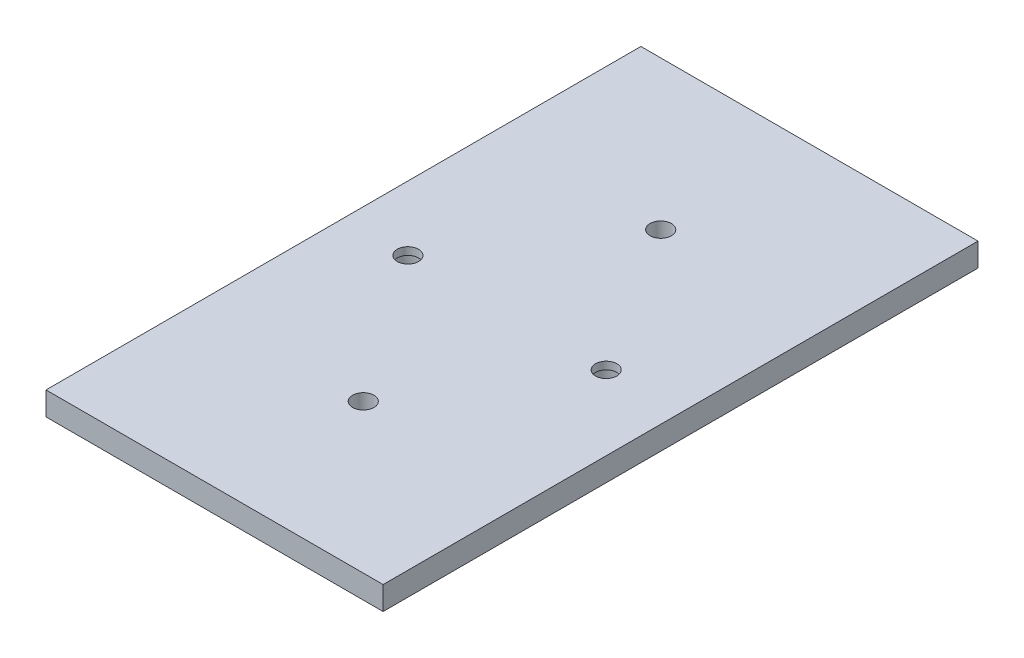
from build123d import *

# Parameters (mm, degrees)
SKETCH2_W               = 88.9
SKETCH2_H               = 152.4
BOSS_EXTRUDE1_DEPTH     = 5.9944
CUT_EXTRUDE2_DEPTH      = 177.535840076
CUT_EXTRUDE2_DEPTH_BACK = 177.535840076
SKETCH4_R               = 2.7305
CUT_EXTRUDE3_DEPTH      = 177.535840076
CUT_EXTRUDE3_DEPTH_BACK = 177.535840076
SKETCH5_R               = 2.7305
CUT_EXTRUDE5_DEPTH      = 177.535840076
CUT_EXTRUDE5_DEPTH_BACK = 177.535840076
SKETCH7_W               = 2.54
SKETCH7_H               = 152.4
SKETCH8_R               = 3.683
CUT_EXTRUDE6_DEPTH      = 4.064


with BuildPart() as part:
    # Sketch2 → Boss-Extrude1 (new body)
    with BuildSketch(Plane(origin=(0, 0, 0), x_dir=(1, 0, 0), z_dir=(0, 1, 0))):
        with Locations((44.45, 76.2)):
            Rectangle(SKETCH2_W, SKETCH2_H)
    extrude(amount=BOSS_EXTRUDE1_DEPTH)

    # Sketch4 → Cut-Extrude2 (cut, two sides: drawn at the far end of the back side and taken through both)
    with BuildSketch(Plane(origin=(0, 5.9944, 0), x_dir=(1, 0, 0), z_dir=(0, 1, 0)).offset(-CUT_EXTRUDE2_DEPTH_BACK)):
        with Locations((45.72, 114.3)):
            Circle(SKETCH4_R)
        with Locations((45.72, 38.1)):
            Circle(SKETCH4_R)
    extrude(amount=CUT_EXTRUDE2_DEPTH + CUT_EXTRUDE2_DEPTH_BACK, mode=Mode.SUBTRACT)

    # Sketch5 → Cut-Extrude3 (cut, two sides: drawn at the far end of the back side and taken through both)
    with BuildSketch(Plane(origin=(0, 5.9944, 0), x_dir=(1, 0, 0), z_dir=(0, 1, 0)).offset(-CUT_EXTRUDE3_DEPTH_BACK)):
        with Locations((69.85, 76.2)):
            Circle(SKETCH5_R)
        with Locations((19.05, 76.2)):
            Circle(SKETCH5_R)
    extrude(amount=CUT_EXTRUDE3_DEPTH + CUT_EXTRUDE3_DEPTH_BACK, mode=Mode.SUBTRACT)

    # Sketch7 → Cut-Extrude5 (cut, two sides: drawn at the far end of the back side and taken through both)
    with BuildSketch(Plane(origin=(0, 5.9944, 0), x_dir=(1, 0, 0), z_dir=(0, 1, 0)).offset(-CUT_EXTRUDE5_DEPTH_BACK)):
        with Locations((1.27, 76.2)):
            Rectangle(SKETCH7_W, SKETCH7_H)
    extrude(amount=CUT_EXTRUDE5_DEPTH + CUT_EXTRUDE5_DEPTH_BACK, mode=Mode.SUBTRACT)

    # Sketch8 → Cut-Extrude6 (cut)
    with BuildSketch(Plane.XZ):
        with Locations((19.05, -76.2)):
            Circle(SKETCH8_R)
        with Locations((69.85, -76.2)):
            Circle(SKETCH8_R)
    extrude(amount=-CUT_EXTRUDE6_DEPTH, mode=Mode.SUBTRACT)


solid = part.part
